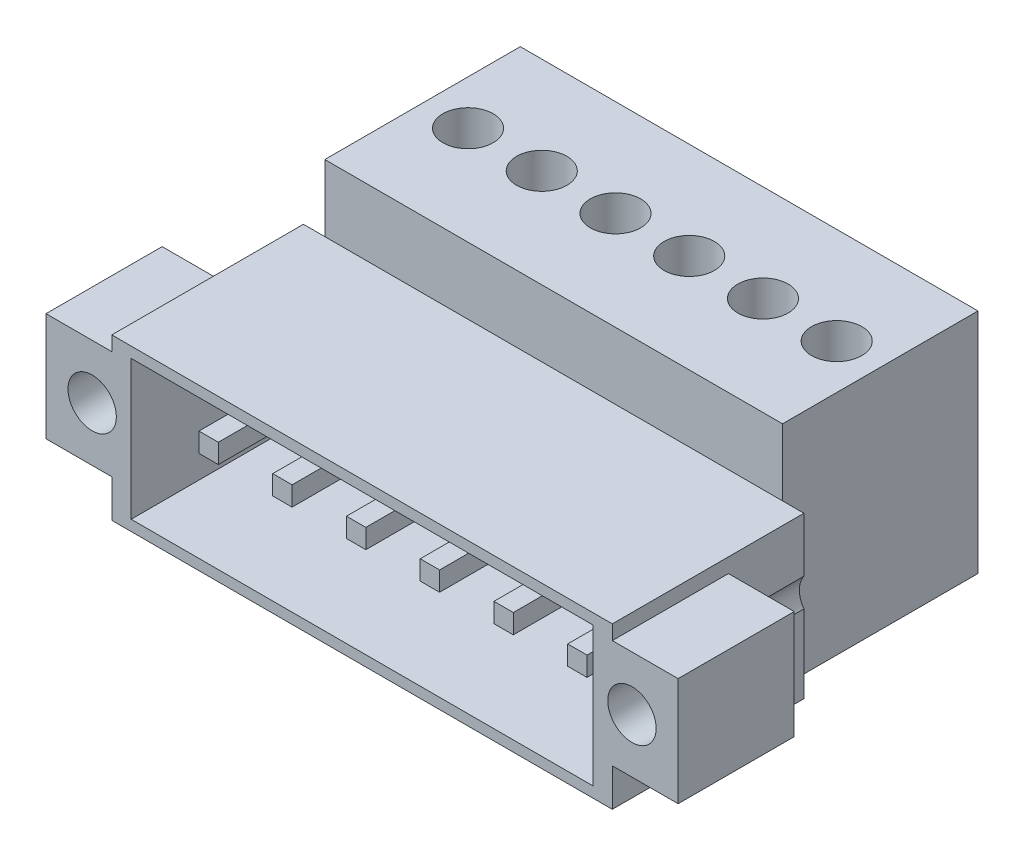
from build123d import *

# Parameters (mm, degrees)
SK_SHROUD_W             = 25.86
SK_SHROUD_H             = 8.3
SHROUD_DEPTH            = 9.9
SK_FLANGE_EARS_W        = 3.4
SK_FLANGE_EARS_H        = 5.6
FLANGE_EARS_DEPTH       = 6
SK_CAVITY_W             = 23.86
SK_CAVITY_H             = 7.2
CAVITY_DEPTH            = 7.6
SK_TERMINAL_BLOCK_W     = 23.65
SK_TERMINAL_BLOCK_H     = 11.75
TERMINAL_BLOCK_DEPTH    = 10.1
INSERT_HOLES_DEPTH      = 25.590016267
INSERT_HOLES_DEPTH_BACK = 25.590016267
SK_INSERT_HOLES_R       = 1.25
SK_CONTACT_PINS_W       = 1
SK_CONTACT_PINS_H       = 1
CONTACT_PINS_DEPTH      = 6
SK_WIRE_ENTRIES_W       = 2.6
SK_WIRE_ENTRIES_H       = 2.8
WIRE_ENTRIES_DEPTH      = 6
SK_CLAMP_SCREW_HOLES_R  = 1.3
CLAMP_SCREW_HOLES_DEPTH = 3


with BuildPart() as part:
    # SK Shroud → Shroud (new body)
    with BuildSketch(Plane.XY.offset(3)):
        with Locations((0, -0.6)):
            Rectangle(SK_SHROUD_W, SK_SHROUD_H)
    extrude(amount=-SHROUD_DEPTH)

    # SK Flange ears → Flange ears (add)
    with BuildSketch(Plane.XY.offset(3)):
        with Locations((14.63, 0)):
            Rectangle(SK_FLANGE_EARS_W, SK_FLANGE_EARS_H)
        with Locations((-14.63, 0)):
            Rectangle(SK_FLANGE_EARS_W, SK_FLANGE_EARS_H)
    extrude(amount=-FLANGE_EARS_DEPTH)

    # SK Cavity → Cavity (cut)
    with BuildSketch(Plane.XY.offset(3)):
        with Locations((0, -0.6)):
            Rectangle(SK_CAVITY_W, SK_CAVITY_H)
    extrude(amount=-CAVITY_DEPTH, mode=Mode.SUBTRACT)

    # SK Terminal block → Terminal block (add)
    with BuildSketch(Plane.XY.offset(-6.9)):
        with Locations((0, 1.125)):
            Rectangle(SK_TERMINAL_BLOCK_W, SK_TERMINAL_BLOCK_H)
    extrude(amount=-TERMINAL_BLOCK_DEPTH)

    # SK Insert holes → Insert holes (cut, two sides: drawn at the far end of the back side and taken through both)
    with BuildSketch(Plane.XY.offset(-INSERT_HOLES_DEPTH_BACK)):
        with Locations((-13.945, 0)):
            Circle(SK_INSERT_HOLES_R)
        with Locations((13.945, 0)):
            Circle(SK_INSERT_HOLES_R)
    extrude(amount=INSERT_HOLES_DEPTH + INSERT_HOLES_DEPTH_BACK, mode=Mode.SUBTRACT)

    # SK Contact pins → Contact pins (add)
    with BuildSketch(Plane.XY.offset(-4.6)):
        with Locations((-9.525, -0.6)):
            Rectangle(SK_CONTACT_PINS_W, SK_CONTACT_PINS_H)
        with Locations((-5.715, -0.6)):
            Rectangle(SK_CONTACT_PINS_W, SK_CONTACT_PINS_H)
        with Locations((-1.905, -0.6)):
            Rectangle(SK_CONTACT_PINS_W, SK_CONTACT_PINS_H)
        with Locations((1.905, -0.6)):
            Rectangle(SK_CONTACT_PINS_W, SK_CONTACT_PINS_H)
        with Locations((5.715, -0.6)):
            Rectangle(SK_CONTACT_PINS_W, SK_CONTACT_PINS_H)
        with Locations((9.525, -0.6)):
            Rectangle(SK_CONTACT_PINS_W, SK_CONTACT_PINS_H)
    extrude(amount=CONTACT_PINS_DEPTH)

    # SK Wire entries → Wire entries (cut)
    with BuildSketch(Plane.XY.offset(-17)):
        with Locations((-9.525, -2)):
            Rectangle(SK_WIRE_ENTRIES_W, SK_WIRE_ENTRIES_H)
        with Locations((-5.715, -2)):
            Rectangle(SK_WIRE_ENTRIES_W, SK_WIRE_ENTRIES_H)
        with Locations((-1.905, -2)):
            Rectangle(SK_WIRE_ENTRIES_W, SK_WIRE_ENTRIES_H)
        with Locations((1.905, -2)):
            Rectangle(SK_WIRE_ENTRIES_W, SK_WIRE_ENTRIES_H)
        with Locations((5.715, -2)):
            Rectangle(SK_WIRE_ENTRIES_W, SK_WIRE_ENTRIES_H)
        with Locations((9.525, -2)):
            Rectangle(SK_WIRE_ENTRIES_W, SK_WIRE_ENTRIES_H)
    extrude(amount=WIRE_ENTRIES_DEPTH, mode=Mode.SUBTRACT)

    # SK Clamp screw holes → Clamp screw holes (cut)
    with BuildSketch(Plane(origin=(0, 7, 0), x_dir=(1, 0, 0), z_dir=(0, 1, 0))):
        with Locations((-9.525, 12)):
            Circle(SK_CLAMP_SCREW_HOLES_R)
        with Locations((-5.715, 12)):
            Circle(SK_CLAMP_SCREW_HOLES_R)
        with Locations((-1.905, 12)):
            Circle(SK_CLAMP_SCREW_HOLES_R)
        with Locations((1.905, 12)):
            Circle(SK_CLAMP_SCREW_HOLES_R)
        with Locations((5.715, 12)):
            Circle(SK_CLAMP_SCREW_HOLES_R)
        with Locations((9.525, 12)):
            Circle(SK_CLAMP_SCREW_HOLES_R)
    extrude(amount=-CLAMP_SCREW_HOLES_DEPTH, mode=Mode.SUBTRACT)


solid = part.part
